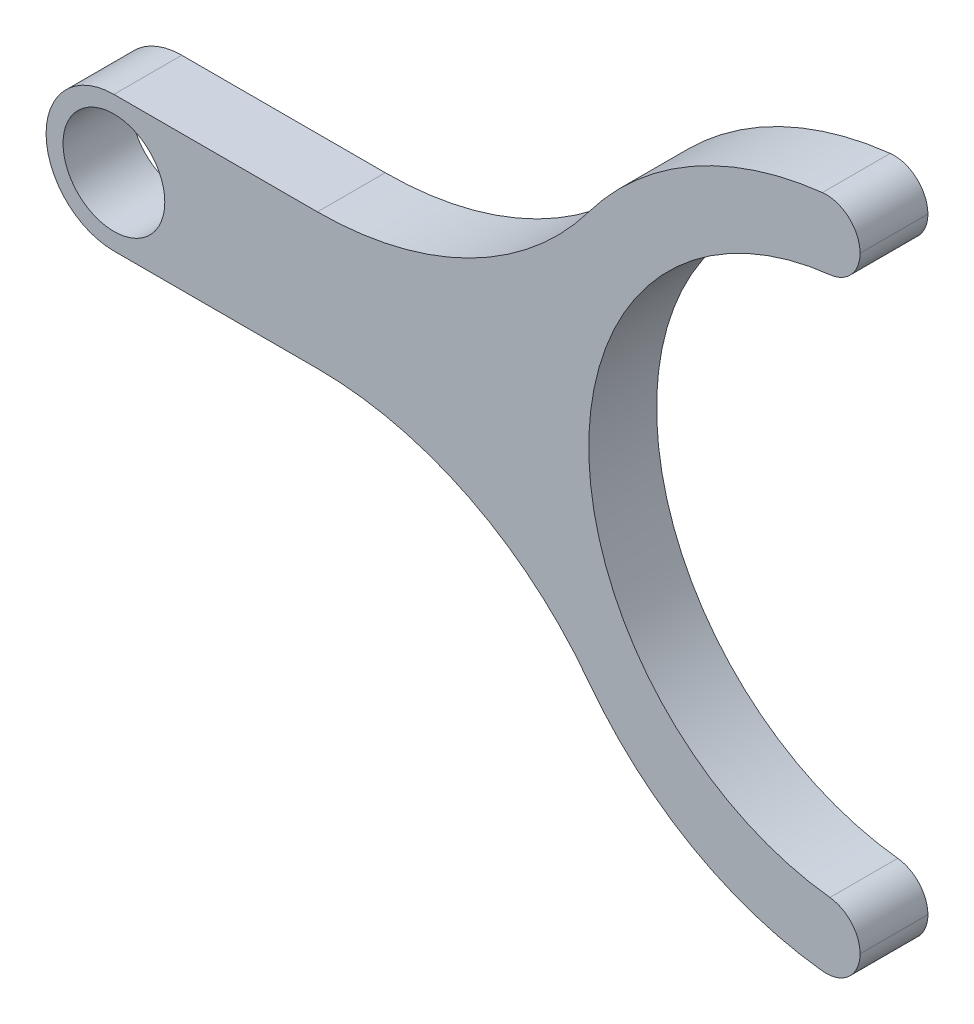
from build123d import *

# Parameters (mm, degrees)
SKETCH1_R           = 7.5
BOSS_EXTRUDE1_DEPTH = 5
FILLET2_R           = 5


with BuildPart() as part:
    # Sketch1 → Boss-Extrude1 (new, symmetric)
    with BuildSketch(Plane.XY):
        with BuildLine():
            Line((40, -50), (40, -40))
            ThreePointArc((40, -40), (0, 0), (40, 40))
            Line((40, 40), (40, 50))
            ThreePointArc((40, 50), (17.639320225, 44.72135955), (0, 30))
            ThreePointArc((0, 30), (-17.639320225, 15.27864045), (-40, 10))
            Line((-40, 10), (-70, 10))
            ThreePointArc((-70, 10), (-80, 0), (-70, -10))
            Line((-70, -10), (-40, -10))
            ThreePointArc((-40, -10), (-17.639320225, -15.27864045), (0, -30))
            ThreePointArc((0, -30), (17.639320225, -44.72135955), (40, -50))
        make_face()
        with Locations((-70, 0)):
            Circle(SKETCH1_R, mode=Mode.SUBTRACT)
    extrude(amount=BOSS_EXTRUDE1_DEPTH, both=True)

    # Fillet2
    fillet2_edges = [part.edges().sort_by_distance(p)[0] for p in [
        (40, -50, 0),
        (40, -40, 0),
        (40, 50, 0),
        (40, 40, 0),
    ]]
    fillet(fillet2_edges, radius=FILLET2_R - 0.0001)  # a hair under: the kernel refuses the full size


solid = part.part
